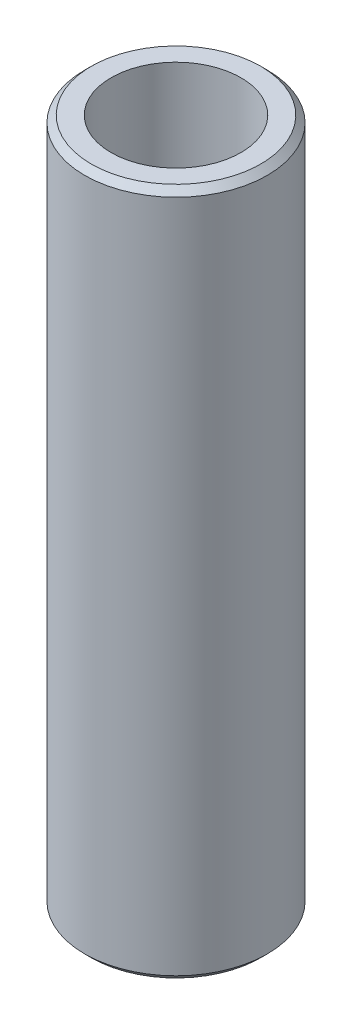
from build123d import *

# Parameters (mm, degrees)
SKETCH1_R           = 20
BOSS_EXTRUDE1_DEPTH = 150.604492007
SKETCH2_R           = 14.22194792
CUT_EXTRUDE1_DEPTH  = 154.237439983
CHAMFER1_SIZE       = 1.436450111


with BuildPart() as part:
    # Sketch1 → Boss-Extrude1 (new body)
    with BuildSketch(Plane(origin=(0, 0, 0), x_dir=(1, 0, 0), z_dir=(0, 1, 0))):
        Circle(SKETCH1_R)
    extrude(amount=BOSS_EXTRUDE1_DEPTH)

    # Sketch2 → Cut-Extrude1 (cut, through all)
    with BuildSketch(Plane(origin=(0, 0, 0), x_dir=(1, 0, 0), z_dir=(0, 1, 0))):
        Circle(SKETCH2_R)
    extrude(amount=CUT_EXTRUDE1_DEPTH, mode=Mode.SUBTRACT)

    # Chamfer1
    chamfer1_edges = [part.edges().sort_by_distance(p)[0] for p in [
        (-20, 150.604492007, 0),
        (-20, 0, 0),
    ]]
    chamfer(chamfer1_edges, length=CHAMFER1_SIZE)


solid = part.part
